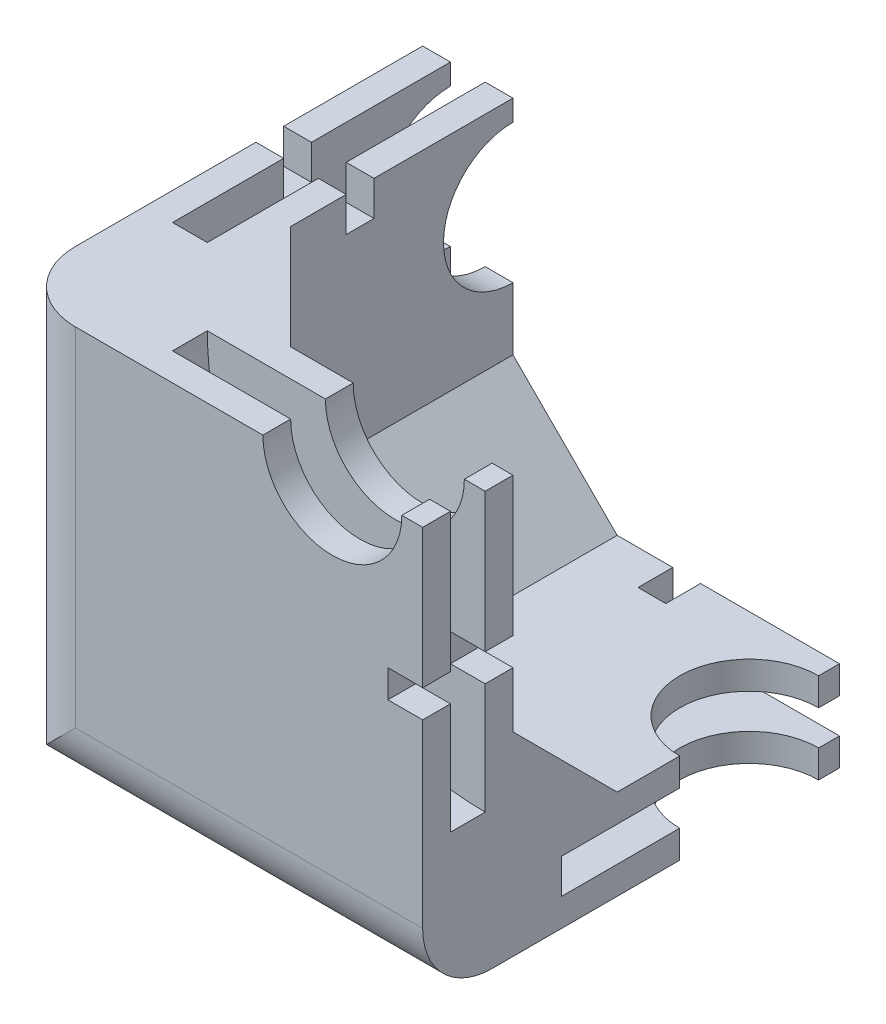
from build123d import *

# Parameters (mm, degrees)
SKETCH_1_W               = 60
SKETCH_1_H               = 60
EXTRUDE_2_DEPTH          = 30
FILLET_4_R               = 10
FILLET_5_R               = 10
SKETCH_5_W               = 47
SKETCH_5_H               = 47
CUT_EXTRUDE_4_DEPTH      = 47
CHAMFER_3_SIZE           = 15
CHAMFER_4_SIZE           = 15
CUT_EXTRUDE_START        = -4
SKETCH_6_R               = 40
CUT_EXTRUDE_5_DEPTH      = 5
SKETCH_7_R               = 10
SKETCH_7_W               = 5
SKETCH_7_H               = 4
CUT_EXTRUDE_6_DEPTH      = 13
PATTERN_CIRCULAR_5_COUNT = 3


with BuildPart() as part:
    # 草图1 → 凸台-拉伸2 (new, symmetric)
    with BuildSketch(Plane(origin=(0, 0, 0), x_dir=(1, 0, 0), z_dir=(0, 1, 0))):
        Rectangle(SKETCH_1_W, SKETCH_1_H)
    extrude(amount=EXTRUDE_2_DEPTH, both=True)

    # 圆角4
    fillet_4_edges = [part.edges().sort_by_distance(p)[0] for p in [
        (0, -30, 30),
        (-30, -30, 0),
    ]]
    fillet(fillet_4_edges, radius=FILLET_4_R)

    # 圆角5
    # the kernel refuses this fillet: 10 mm, written as the material it takes off along each edge
    with BuildSketch(Plane(origin=(-30, -45, 30), x_dir=(0, 0, -1), z_dir=(0, 1, 0))) as fillet_5_piece_1:
        with BuildLine():
            CenterArc((FILLET_5_R, -FILLET_5_R), FILLET_5_R, 90, 90)
            Line((0, -FILLET_5_R), (0, 0))
            Line((0, 0), (FILLET_5_R, 0))
        make_face()
    extrude(amount=100, mode=Mode.SUBTRACT)

    # 草图5 → 切除-拉伸4 (cut)
    with BuildSketch(Plane(origin=(0, 30, 0), x_dir=(1, 0, 0), z_dir=(0, 1, 0))):
        with Locations((6.5, 6.5)):
            Rectangle(SKETCH_5_W, SKETCH_5_H)
    extrude(amount=-CUT_EXTRUDE_4_DEPTH, mode=Mode.SUBTRACT)

    # 倒角3
    chamfer_3_edges = [part.edges().sort_by_distance(p)[0] for p in [
        (6.5, -17, 17),
        (-17, -17, -6.5),
    ]]
    chamfer(chamfer_3_edges, length=CHAMFER_3_SIZE)

    # 倒角4
    chamfer_4_edges = [part.edges().sort_by_distance(p)[0] for p in [
        (-17, 14, 17),
    ]]
    chamfer(chamfer_4_edges, length=CHAMFER_4_SIZE)

    # 草图6 → 切除-拉伸5 (cut)
    with BuildSketch(Plane.XY.offset(30).offset(CUT_EXTRUDE_START)):
        with Locations((30, 30)):
            Circle(SKETCH_6_R)
    cut_extrude_5 = extrude(amount=-CUT_EXTRUDE_5_DEPTH, mode=Mode.SUBTRACT)

    # 草图7 → 切除-拉伸6 (cut)
    with BuildSketch(Plane.XY.offset(30)):
        with Locations((17, 30)):
            Circle(SKETCH_7_R)
        with Locations((27.5, 8)):
            Rectangle(SKETCH_7_W, SKETCH_7_H)
    cut_extrude_6 = extrude(amount=-CUT_EXTRUDE_6_DEPTH, mode=Mode.SUBTRACT)

    # 阵列(圆周)5: 切除-拉伸5, 切除-拉伸6 ×3 about axis
    pattern_circular_5_axis = Axis((0, 0, 0), (-0.5773502691896262, -0.5773502691896245, 0.5773502691896266))
    add([cut_extrude_5.rotate(pattern_circular_5_axis, i * 360 / PATTERN_CIRCULAR_5_COUNT) for i in range(1, PATTERN_CIRCULAR_5_COUNT)], mode=Mode.SUBTRACT)
    add([cut_extrude_6.rotate(pattern_circular_5_axis, i * 360 / PATTERN_CIRCULAR_5_COUNT) for i in range(1, PATTERN_CIRCULAR_5_COUNT)], mode=Mode.SUBTRACT)


solid = part.part
